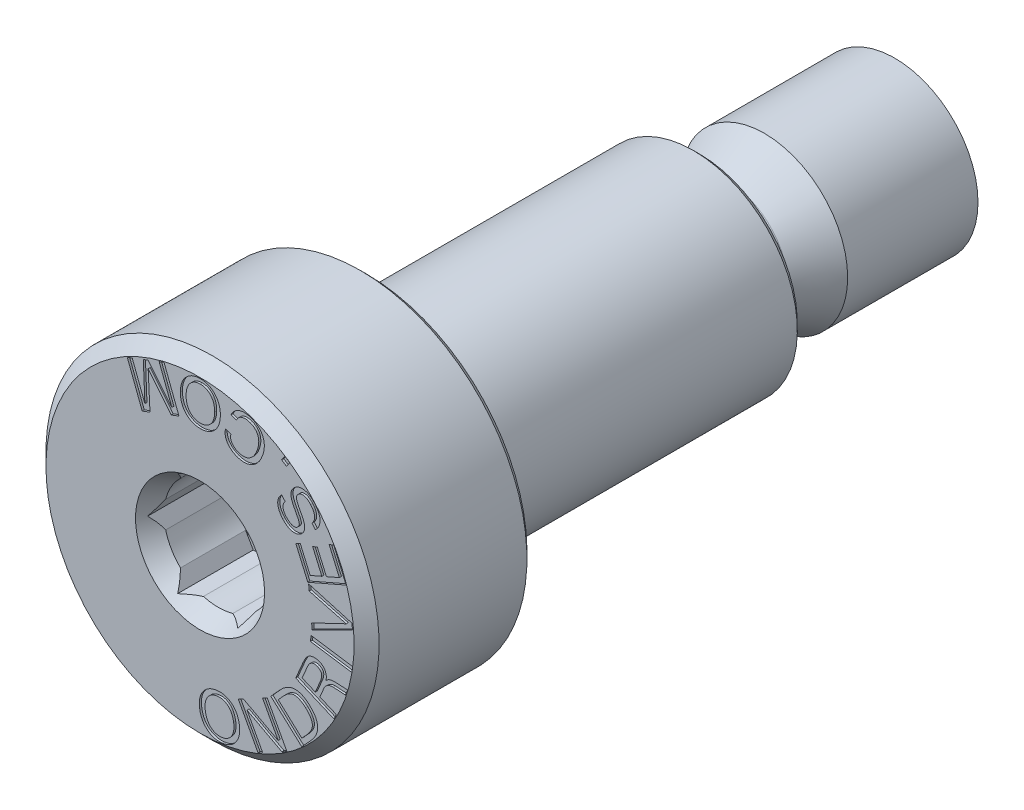
from build123d import *

# Parameters (mm, degrees)
HEX_2_DEPTH                 = 2
SHOULDER_CHAMFER_SIZE       = 0.15
HEAD_CHAMFER_SIZE           = 0.3
HEAD_UNDERSIDE_CHAMFER_SIZE = 0.15
FILLET1_R                   = 0.2
FILLET2_R                   = 0.2
CUT_EXTRUDE1_DEPTH          = 0.05


with BuildPart() as part:
    # Sketch1 → BODY (revolve)
    with BuildSketch(Plane(origin=(0, 0, 0), x_dir=(0, 0, -1), z_dir=(1, 0, 0))):
        Polygon((0, 2.4935), (0, 4), (-4, 4), (-4, 0), (13, 0), (13, 2), (8, 2), (8, 2.4935), align=None)
    revolve(axis=Axis((0, 0, 4), (0, 0, 1)))

    # Sketch2 → HEX DRILL (revolve, cut)
    with BuildSketch(Plane(origin=(0, 0, 0), x_dir=(0, 0, -1), z_dir=(1, 0, 0))):
        Polygon((-4, 0), (-0.819482056, 0), (-1.6, 1.299), (-3.565255247, 1.299), (-4, 1.55), align=None)
    revolve(axis=Axis((0, 0, 0.819482056), (0, 0, -1)), mode=Mode.SUBTRACT)

    # Sketch3 → HEX 2 (cut)
    with BuildSketch(Plane.XY.offset(4)):
        Polygon((0.721687836, 1.25), (-0.721687836, 1.25), (-1.443375673, 0), (-0.721687836, -1.25), (0.721687836, -1.25), (1.443375673, 0), align=None)
    extrude(amount=-HEX_2_DEPTH, mode=Mode.SUBTRACT)

    # SHOULDER CHAMFER
    shoulder_chamfer_edges = [part.edges().sort_by_distance(p)[0] for p in [
        (0, -2.4935, -8),
    ]]
    chamfer(shoulder_chamfer_edges, length=SHOULDER_CHAMFER_SIZE)

    # HEAD CHAMFER
    head_chamfer_edges = [part.edges().sort_by_distance(p)[0] for p in [
        (0, -4, 4),
    ]]
    chamfer(head_chamfer_edges, length=HEAD_CHAMFER_SIZE)

    # HEAD UNDERSIDE CHAMFER
    head_underside_chamfer_edges = [part.edges().sort_by_distance(p)[0] for p in [
        (0, -4, 0),
    ]]
    chamfer(head_underside_chamfer_edges, length=HEAD_UNDERSIDE_CHAMFER_SIZE)

    # Sketch4 → Cut-Revolve2 (revolve, cut)
    with BuildSketch(Plane(origin=(0, 0, 0), x_dir=(0, 0, -1), z_dir=(1, 0, 0))):
        with BuildLine():
            Line((0.2, 2.21), (0.6, 2.21))
            Line((0.6, 2.21), (0.8835, 2.4935))
            Line((0.8835, 2.4935), (0.018264615, 2.4935))
            ThreePointArc((0.018264615, 2.4935), (0.031625418, 2.302064834), (0.2, 2.21))
        make_face()
    revolve(axis=Axis((0, 0, 0), (0, 0, -1)), mode=Mode.SUBTRACT)

    # Fillet1
    fillet1_edges = [part.edges().sort_by_distance(p)[0] for p in [
        (0, -2.21, -0.6),
    ]]
    fillet(fillet1_edges, radius=FILLET1_R)

    # Sketch5 → Cut-Revolve4 (revolve, cut)
    with BuildSketch(Plane(origin=(0, 0, 0), x_dir=(0, 0, -1), z_dir=(1, 0, 0))):
        with BuildLine():
            Line((0.018264615, 2.4935), (0, 2.4935))
            Line((0, 2.4935), (0, 2.41))
            ThreePointArc((0, 2.41), (0.395380497, 2.367262879), (0.018264615, 2.4935))
        make_face()
    revolve(axis=Axis((0, 0, 0), (0, 0, -1)), mode=Mode.SUBTRACT)

    # Sketch6 → Cut-Revolve3 (revolve, cut)
    with BuildSketch(Plane(origin=(0, 0, 0), x_dir=(0, 0, -1), z_dir=(1, 0, 0))):
        with BuildLine():
            Line((8.4, 1.45), (8.6, 1.45))
            Line((8.6, 1.45), (9.552627944, 2))
            Line((9.552627944, 2), (8, 2))
            Line((8, 2), (8, 1.85))
            ThreePointArc((8, 1.85), (8.117157288, 1.567157288), (8.4, 1.45))
        make_face()
        Polygon((13, 2), (13, 1.45), (12.682457352, 2), align=None)
    revolve(axis=Axis((0, 0, 0), (0, 0, -1)), mode=Mode.SUBTRACT)

    # Fillet2
    fillet2_edges = [part.edges().sort_by_distance(p)[0] for p in [
        (0, -1.45, -8.6),
    ]]
    fillet(fillet2_edges, radius=FILLET2_R)

    # Sketch7 → Cut-Extrude1 (cut)
    # profile 1 of 12: a face of its own
    with BuildSketch(Plane.XY.offset(4)):
        with BuildLine():
            add(Edge.make_bspline(
                [(0.392857143, -2.608076299), (0.409944291, -2.605996782), (0.443492826, -2.601913905), (0.49340195, -2.601364969), (0.541595046, -2.605606119), (0.588055051, -2.614529224), (0.632803978, -2.628139768), (0.675726199, -2.646784319), (0.716856609, -2.67032592), (0.756057419, -2.698201204), (0.79261526, -2.73019233), (0.825518216, -2.766098362), (0.854951368, -2.805229793), (0.880478803, -2.847936501), (0.901823778, -2.894251183), (0.920031125, -2.943791126), (0.934291651, -2.996841907), (0.940446494, -3.033676732), (0.943587662, -3.052475649)],
                knots=[0, 0, 0, 0, 1.038003315, 2.037993161, 3.004982196, 3.952684401, 4.887378919, 5.821458422, 6.77011804, 7.741772548, 8.719272317, 9.695544412, 10.675052872, 11.668961054, 12.691443159, 13.747621115, 14.850482264, 16, 16, 16, 16], degree=3))
            add(Edge.make_bspline(
                [(0.943587662, -3.052475649), (0.946010205, -3.071386096), (0.950755602, -3.108428828), (0.95221853, -3.163305086), (0.94946001, -3.21597603), (0.942368216, -3.266473163), (0.9299794, -3.314680114), (0.913403128, -3.360688831), (0.892109675, -3.404496286), (0.86641199, -3.445611187), (0.837123586, -3.483816191), (0.804288481, -3.517991731), (0.768586148, -3.548284593), (0.729748408, -3.574454124), (0.687768746, -3.596357318), (0.642825538, -3.614249625), (0.594923457, -3.628243101), (0.561623757, -3.633970563), (0.544642857, -3.636891234)],
                knots=[0, 0, 0, 0, 1.149806952, 2.252299548, 3.306879543, 4.329704194, 5.32358445, 6.304847134, 7.275973205, 8.256768914, 9.225808524, 10.17553937, 11.110990128, 12.046040113, 12.995376215, 13.962479904, 14.960983915, 16, 16, 16, 16], degree=3))
            add(Edge.make_bspline(
                [(0.544642857, -3.636891234), (0.527487543, -3.638977032), (0.493802378, -3.643072583), (0.443703164, -3.643532139), (0.395292341, -3.639614172), (0.348593724, -3.630694818), (0.303676697, -3.616726497), (0.260395714, -3.598258892), (0.21902632, -3.574636014), (0.179627742, -3.546765961), (0.142866639, -3.514838672), (0.109952092, -3.478867286), (0.080523958, -3.439691302), (0.054869831, -3.397076403), (0.033090063, -3.350969898), (0.015396525, -3.301436979), (0.000890312, -3.24862543), (-0.005200434, -3.211906319), (-0.008319805, -3.193100649)],
                knots=[0, 0, 0, 0, 1.040160315, 2.042397535, 3.011327481, 3.96129936, 4.899378268, 5.839233499, 6.789703145, 7.762905742, 8.741685769, 9.716175024, 10.693894732, 11.688085062, 12.706746762, 13.759601857, 14.852581481, 16, 16, 16, 16], degree=3))
            add(Edge.make_bspline(
                [(-0.008319805, -3.193100649), (-0.010744854, -3.174122126), (-0.015478411, -3.137077124), (-0.016922428, -3.082140496), (-0.014298386, -3.029507284), (-0.006778117, -2.978997739), (0.005446446, -2.930754459), (0.022038243, -2.884635348), (0.043583725, -2.840877031), (0.069455093, -2.799743937), (0.099028263, -2.761546421), (0.131932243, -2.72718034), (0.167933298, -2.696818824), (0.207078091, -2.670819264), (0.249206885, -2.648798763), (0.294228146, -2.630671502), (0.342381253, -2.616739054), (0.37581067, -2.611001842), (0.392857143, -2.608076299)],
                knots=[0, 0, 0, 0, 1.150991414, 2.246669977, 3.302690165, 4.31953488, 5.31488737, 6.293707363, 7.264202467, 8.244714458, 9.213833658, 10.166956776, 11.103191265, 12.042677806, 12.989650693, 13.95964181, 14.959571765, 16, 16, 16, 16], degree=3))
        make_face()
        with BuildLine():
            add(Edge.make_bspline(
                [(0.526582792, -3.524472403), (0.538738437, -3.522327562), (0.56255723, -3.518124782), (0.596885721, -3.508140855), (0.628914554, -3.494899745), (0.658765984, -3.478537545), (0.686507708, -3.459204376), (0.71201223, -3.436722435), (0.735256029, -3.411184808), (0.756089503, -3.382738626), (0.77451326, -3.35175448), (0.789139738, -3.318128213), (0.800942518, -3.282512776), (0.808860186, -3.244653118), (0.813796377, -3.204606075), (0.815073313, -3.162446743), (0.813034099, -3.118082665), (0.80919853, -3.088033748), (0.807224026, -3.072564935)],
                knots=[0, 0, 0, 0, 0.987975974, 1.935923156, 2.856371812, 3.758174173, 4.656798552, 5.558747319, 6.47515452, 7.416641387, 8.378172633, 9.355518478, 10.34733305, 11.377900405, 12.447531076, 13.574871874, 14.751573839, 16, 16, 16, 16], degree=3))
            add(Edge.make_bspline(
                [(0.807224026, -3.072564935), (0.804648273, -3.05724022), (0.799621966, -3.027335668), (0.788973688, -2.984244525), (0.775297645, -2.944322792), (0.759280895, -2.9074352), (0.740847982, -2.873441004), (0.719476733, -2.84274361), (0.695533706, -2.815053174), (0.669184137, -2.790603332), (0.64105949, -2.769279656), (0.61152788, -2.751524354), (0.580827587, -2.737391201), (0.548979621, -2.726791398), (0.51598794, -2.719631128), (0.481826701, -2.716227037), (0.446518568, -2.716387616), (0.422803601, -2.719242633), (0.410714286, -2.720698052)],
                knots=[0, 0, 0, 0, 1.249303025, 2.437882089, 3.564513094, 4.638678557, 5.668337911, 6.668690425, 7.640359467, 8.606333552, 9.553831924, 10.473572194, 11.371618306, 12.266016862, 13.167482487, 14.080507821, 15.021489362, 16, 16, 16, 16], degree=3))
            add(Edge.make_bspline(
                [(0.410714286, -2.720698052), (0.398553413, -2.722825947), (0.374641613, -2.727010005), (0.340249317, -2.737289116), (0.307973973, -2.750453176), (0.277938092, -2.766848099), (0.249910728, -2.786148467), (0.224343025, -2.808858436), (0.200819406, -2.834372662), (0.179781587, -2.862828387), (0.161240358, -2.893775689), (0.146189824, -2.92729533), (0.134628335, -2.962958193), (0.126532805, -3.00084153), (0.121775781, -3.040844677), (0.120109397, -3.082987751), (0.12225783, -3.127291816), (0.126077508, -3.157340004), (0.128043831, -3.172808442)],
                knots=[0, 0, 0, 0, 0.98578933, 1.938347571, 2.86175514, 3.766305235, 4.667376931, 5.574957677, 6.492987375, 7.435603514, 8.397758293, 9.370211219, 10.364968355, 11.387971388, 12.460599677, 13.580239302, 14.754336925, 16, 16, 16, 16], degree=3))
            add(Edge.make_bspline(
                [(0.128043831, -3.172808442), (0.130584397, -3.188142609), (0.135534032, -3.218017258), (0.146629514, -3.260848104), (0.159900935, -3.300789287), (0.176210587, -3.33753623), (0.194830414, -3.371488525), (0.216263651, -3.402230251), (0.24007467, -3.430177324), (0.266713914, -3.454556921), (0.295019686, -3.475899606), (0.324759808, -3.493648485), (0.355661293, -3.507781098), (0.387711631, -3.518379363), (0.420905096, -3.525539877), (0.455267809, -3.528941336), (0.490711109, -3.528790733), (0.514493408, -3.525927756), (0.526582792, -3.524472403)],
                knots=[0, 0, 0, 0, 1.246392284, 2.428272094, 3.545393326, 4.619238309, 5.649118157, 6.647139958, 7.620652302, 8.588354935, 9.53798128, 10.460236012, 11.361122493, 12.258586807, 13.163256899, 14.079553684, 15.023769186, 16, 16, 16, 16], degree=3))
        make_face(mode=Mode.SUBTRACT)
    # profile 2 of 12: a face of its own
    with BuildSketch(Plane.XY.offset(4)):
        Polygon((2.087580961, -3.039495153), (1.967654013, -3.104024373), (1.129788753, -2.655972425), (1.504991675, -3.353009763), (1.394196221, -3.412668854), (0.918749792, -2.529551971), (1.038067974, -2.465225672), (1.875933234, -2.91327762), (1.500730312, -2.216240282), (1.612134532, -2.156378269), align=None)
    # profile 3 of 12: a face of its own
    with BuildSketch(Plane.XY.offset(4)):
        with BuildLine():
            Line((1.699921706, -2.081029823), (1.915424953, -1.845031446))
            add(Edge.make_bspline(
                [(1.915424953, -1.845031446), (1.929693192, -1.829942814), (1.957327444, -1.800719653), (2.000919792, -1.76160274), (2.04464792, -1.728083574), (2.088601928, -1.700080686), (2.132755508, -1.677474041), (2.177228823, -1.660747034), (2.221846597, -1.649310202), (2.26672133, -1.643798482), (2.311777678, -1.644052786), (2.356935906, -1.649829275), (2.402288044, -1.661116377), (2.447729439, -1.678119148), (2.493170047, -1.701005301), (2.538836943, -1.72911801), (2.584761319, -1.762733652), (2.614014071, -1.788512808), (2.629101901, -1.801809044)],
                knots=[0, 0, 0, 0, 1.21490475, 2.352987131, 3.423389498, 4.435896103, 5.398940926, 6.320913209, 7.210897382, 8.088291991, 8.959161664, 9.840974181, 10.746319392, 11.688216062, 12.674261419, 13.719091789, 14.823565309, 16, 16, 16, 16], degree=3))
            add(Edge.make_bspline(
                [(2.629101901, -1.801809044), (2.644075576, -1.815923572), (2.673140972, -1.843321278), (2.711709565, -1.88692244), (2.744870317, -1.930574262), (2.77228429, -1.974647755), (2.794281244, -2.018926121), (2.810211852, -2.063714982), (2.820709299, -2.108705584), (2.825735551, -2.154020315), (2.824631839, -2.199648107), (2.817750408, -2.245455124), (2.805499993, -2.291553767), (2.787370672, -2.337877628), (2.763626881, -2.38438877), (2.734427041, -2.431263995), (2.699337797, -2.478200499), (2.672809431, -2.508427205), (2.659134368, -2.524008719)],
                knots=[0, 0, 0, 0, 1.190504873, 2.310888595, 3.364818141, 4.359976138, 5.310716772, 6.220867259, 7.105014897, 7.979216468, 8.852488288, 9.73892131, 10.654369589, 11.6075254, 12.612530503, 13.672839738, 14.800376086, 16, 16, 16, 16], degree=3))
            Line((2.659134368, -2.524008719), (2.443631121, -2.760007096))
            Line((2.443631121, -2.760007096), (1.699921706, -2.081029823))
        make_face()
        with BuildLine():
            Line((2.445254498, -2.581029823), (2.569036965, -2.445477875))
            add(Edge.make_bspline(
                [(2.569036965, -2.445477875), (2.580656332, -2.432308419), (2.602956891, -2.407032839), (2.632098938, -2.368127629), (2.656166718, -2.330412558), (2.674556195, -2.293440684), (2.688124378, -2.257681652), (2.6959121, -2.222765259), (2.698899298, -2.188911312), (2.695798925, -2.155938045), (2.688137061, -2.123812331), (2.677377968, -2.091762457), (2.662849936, -2.059841499), (2.644672742, -2.028082592), (2.622752507, -1.996608159), (2.597472933, -1.965084751), (2.568671746, -1.933545481), (2.547330101, -1.913544797), (2.536366511, -1.903270083)],
                knots=[0, 0, 0, 0, 1.337153383, 2.566342045, 3.698361972, 4.739725707, 5.70627822, 6.603674714, 7.456334301, 8.283750727, 9.113553327, 9.967208358, 10.854881444, 11.780133249, 12.750426554, 13.773016635, 14.855958244, 16, 16, 16, 16], degree=3))
            add(Edge.make_bspline(
                [(2.536366511, -1.903270083), (2.525379625, -1.893607126), (2.504029168, -1.874829416), (2.471086955, -1.84948081), (2.438132755, -1.827938302), (2.405503145, -1.809751163), (2.372991402, -1.795186898), (2.340748104, -1.784114415), (2.308571218, -1.776786386), (2.276553216, -1.772629045), (2.244035396, -1.773159725), (2.21102442, -1.779206355), (2.177471077, -1.790933666), (2.143261276, -1.807770047), (2.108484037, -1.829957768), (2.073091661, -1.857376426), (2.037140889, -1.890227527), (2.013951459, -1.91481214), (2.001869758, -1.927620732)],
                knots=[0, 0, 0, 0, 1.130369586, 2.196610441, 3.208432335, 4.169894706, 5.079982318, 5.957600745, 6.799443772, 7.625978541, 8.44667622, 9.301671199, 10.207396311, 11.184443287, 12.241485861, 13.389300916, 14.639824903, 16, 16, 16, 16], degree=3))
            Line((2.001869758, -1.927620732), (1.87808729, -2.06317268))
            Line((1.87808729, -2.06317268), (2.445254498, -2.581029823))
        make_face(mode=Mode.SUBTRACT)
    # profile 4 of 12: a face of its own
    with BuildSketch(Plane.XY.offset(4)):
        with BuildLine():
            Line((3.546720265, -1.029082384), (3.490307927, -1.160981734))
            Line((3.490307927, -1.160981734), (3.207840395, -1.14292167))
            add(Edge.make_bspline(
                [(3.207840395, -1.14292167), (3.195514336, -1.142622638), (3.171206386, -1.142032924), (3.13519254, -1.147538297), (3.100630112, -1.158205278), (3.067834295, -1.17376971), (3.037785536, -1.193931771), (3.011569697, -1.218657633), (2.989632096, -1.247814351), (2.979054336, -1.269877444), (2.973668317, -1.281111605)],
                knots=[0, 0, 0, 0, 1.018563735, 2.008687244, 2.998241207, 4.002061673, 5.001676834, 5.979514034, 6.971202108, 8, 8, 8, 8], degree=3))
            Line((2.973668317, -1.281111605), (2.877686174, -1.506355111))
            Line((2.877686174, -1.506355111), (3.271355005, -1.674374592))
            Line((3.271355005, -1.674374592), (3.219204031, -1.79633076))
            Line((3.219204031, -1.79633076), (2.298952408, -1.40367654))
            Line((2.298952408, -1.40367654), (2.472856628, -0.996209007))
            add(Edge.make_bspline(
                [(2.472856628, -0.996209007), (2.480375152, -0.979343532), (2.494720184, -0.947164901), (2.518204708, -0.90263117), (2.542151159, -0.864031327), (2.56295329, -0.835762674), (2.580810389, -0.816490278), (2.594742504, -0.80354828), (2.610167523, -0.792477772), (2.626323325, -0.782393327), (2.643820794, -0.77411252), (2.662248951, -0.766985547), (2.681869768, -0.761288808), (2.709337556, -0.75570075), (2.744566905, -0.752304792), (2.787162674, -0.754302541), (2.829598786, -0.762843734), (2.856774492, -0.773207329), (2.870583901, -0.778473618)],
                knots=[0, 0, 0, 0, 1.70512306, 3.253304621, 4.645228063, 5.898403787, 6.486327414, 7.070020721, 7.651033447, 8.2370955, 8.826643183, 9.435726208, 10.060434962, 10.711002471, 12.022608216, 13.317263415, 14.636760106, 16, 16, 16, 16], degree=3))
            add(Edge.make_bspline(
                [(2.870583901, -0.778473618), (2.878287811, -0.781934379), (2.893456266, -0.788748373), (2.914811657, -0.800940902), (2.934263818, -0.814666033), (2.95242419, -0.829257587), (2.968501163, -0.845526722), (2.983144153, -0.862846374), (2.995739602, -0.881691825), (3.006626873, -0.901681854), (3.015781376, -0.922664712), (3.02314646, -0.94437017), (3.02833296, -0.966813823), (3.031975029, -0.98986535), (3.03292893, -1.013652372), (3.032644851, -1.038129472), (3.030222868, -1.063320122), (3.027034667, -1.080172126), (3.025413447, -1.088741475)],
                knots=[0, 0, 0, 0, 1.069422075, 2.105616455, 3.108690089, 4.082914408, 5.052303838, 6.001256995, 6.951833419, 7.918074794, 8.881157826, 9.848462341, 10.816942542, 11.796052859, 12.799858129, 13.828193683, 14.895623066, 16, 16, 16, 16], degree=3))
            Line((3.025413447, -1.088741475), (3.028051434, -1.089959007))
            add(Edge.make_bspline(
                [(3.028051434, -1.089959007), (3.034278844, -1.083248572), (3.046730934, -1.069830644), (3.069186687, -1.053455822), (3.093812472, -1.039442687), (3.121427134, -1.028803768), (3.151464987, -1.020625804), (3.184283905, -1.015795458), (3.219642702, -1.013182051), (3.24409295, -1.014032127), (3.256744616, -1.014471994)],
                knots=[0, 0, 0, 0, 0.878686172, 1.756986892, 2.659999839, 3.597508822, 4.594934075, 5.64851335, 6.783234305, 8, 8, 8, 8], degree=3))
            Line((3.256744616, -1.014471994), (3.546720265, -1.029082384))
        make_face()
        with BuildLine():
            Line((2.768514096, -1.459885955), (2.884382603, -1.188173293))
            add(Edge.make_bspline(
                [(2.884382603, -1.188173293), (2.888202697, -1.17901273), (2.895580486, -1.161320839), (2.90465155, -1.135060652), (2.912088417, -1.110324542), (2.917421644, -1.087005123), (2.920690424, -1.065159194), (2.922275371, -1.044796747), (2.921648762, -1.02589444), (2.919337084, -1.008269702), (2.91461148, -0.991864529), (2.907622126, -0.976386119), (2.898192761, -0.961932724), (2.886434018, -0.948449137), (2.872490081, -0.935765479), (2.856186442, -0.92406942), (2.837598703, -0.913190646), (2.824046345, -0.907194481), (2.817012473, -0.904082384)],
                knots=[0, 0, 0, 0, 1.411492425, 2.726029862, 3.949903519, 5.084314312, 6.125271904, 7.089786383, 7.985060685, 8.811006594, 9.611914552, 10.404222843, 11.218201161, 12.057268734, 12.942665136, 13.893403926, 14.906645734, 16, 16, 16, 16], degree=3))
            add(Edge.make_bspline(
                [(2.817012473, -0.904082384), (2.810630189, -0.901523465), (2.798181386, -0.89653223), (2.779327318, -0.891322028), (2.76106615, -0.887966257), (2.74335535, -0.886625539), (2.726203194, -0.887766742), (2.709531994, -0.89050443), (2.69350141, -0.895619898), (2.678094036, -0.902892374), (2.66315602, -0.912024587), (2.649030986, -0.923532506), (2.635272633, -0.936868895), (2.622117661, -0.952259741), (2.609786426, -0.969920638), (2.597796544, -0.989399472), (2.586410834, -1.010958591), (2.579636089, -1.026265374), (2.576143966, -1.034155436)],
                knots=[0, 0, 0, 0, 1.054097199, 2.05604291, 2.994289014, 3.899123989, 4.77223018, 5.625127461, 6.484876442, 7.343623093, 8.233400928, 9.163522538, 10.13208704, 11.169714566, 12.263705122, 13.432855381, 14.676735065, 16, 16, 16, 16], degree=3))
            Line((2.576143966, -1.034155436), (2.452158577, -1.324739851))
            Line((2.452158577, -1.324739851), (2.768514096, -1.459885955))
        make_face(mode=Mode.SUBTRACT)
    # profile 5 of 12: a face of its own
    with BuildSketch(Plane.XY.offset(4)):
        Polygon((3.663915677, -0.483458485), (3.643826392, -0.61576368), (2.649102366, -0.465195498), (2.669191651, -0.332890303), align=None)
    # profile 6 of 12: a face of its own
    with BuildSketch(Plane.XY.offset(4)):
        Polygon((2.608063825, 0.70989237), (3.648242396, 0.412611525), (3.661026487, 0.275639123), (2.693088176, -0.207721267), (2.679898241, -0.066081656), (3.511675838, 0.33103685), (2.62125376, 0.568049837), align=None)
    # profile 7 of 12: a face of its own
    with BuildSketch(Plane.XY.offset(4)):
        Polygon((3.209997955, 1.8205513), (3.508496332, 1.134268832), (2.588244708, 0.733903572), (2.299080747, 1.398879222), (2.408252825, 1.446362988), (2.644454124, 0.903343507), (2.925704124, 1.02570552), (2.704924903, 1.533416559), (2.814096981, 1.580900326), (3.034876202, 1.073189287), (3.346361592, 1.208741235), (3.100825877, 1.773067533), align=None)
    # profile 8 of 12: a face of its own
    with BuildSketch(Plane.XY.offset(4)):
        with BuildLine():
            add(Edge.make_bspline(
                [(2.743250583, 2.465013108), (2.754444657, 2.451961058), (2.776130671, 2.426675627), (2.804906451, 2.387646446), (2.828910702, 2.348957091), (2.848806133, 2.310989985), (2.864232318, 2.273455755), (2.875092689, 2.236393143), (2.881554693, 2.199838491), (2.883287359, 2.163933833), (2.881252325, 2.128981559), (2.875733123, 2.095135677), (2.867038035, 2.062538365), (2.854872887, 2.031142803), (2.839514194, 2.000856787), (2.82038773, 1.971976459), (2.798268992, 1.944160245), (2.781302445, 1.92717939), (2.772674285, 1.918543953)],
                knots=[0, 0, 0, 0, 1.340023787, 2.595996541, 3.775245837, 4.885954812, 5.933590996, 6.933045793, 7.890871631, 8.820043748, 9.728444802, 10.615181148, 11.488714882, 12.35330809, 13.235203311, 14.130177804, 15.049121406, 16, 16, 16, 16], degree=3))
            Line((2.772674285, 1.918543953), (2.687649934, 2.014526096))
            add(Edge.make_bspline(
                [(2.687649934, 2.014526096), (2.693724773, 2.021321409), (2.705618332, 2.034625541), (2.720996154, 2.055891952), (2.732906458, 2.078054534), (2.742508113, 2.100387645), (2.748674372, 2.123360932), (2.752620557, 2.146679713), (2.752759085, 2.170630397), (2.750556479, 2.194893529), (2.745763223, 2.219230868), (2.739102036, 2.243402234), (2.730286932, 2.267267483), (2.71950239, 2.290767875), (2.706846599, 2.314036454), (2.692225722, 2.336969347), (2.67551328, 2.359533295), (2.663246195, 2.374035313), (2.6570087, 2.381409212)],
                knots=[0, 0, 0, 0, 1.068329069, 2.091616828, 3.067561728, 4.013100556, 4.934690982, 5.849947378, 6.777930258, 7.733558383, 8.702518762, 9.681840922, 10.6703672, 11.681754962, 12.710864738, 13.773438714, 14.867851476, 16, 16, 16, 16], degree=3))
            add(Edge.make_bspline(
                [(2.6570087, 2.381409212), (2.650840604, 2.388088334), (2.638798704, 2.401127902), (2.620232695, 2.419393486), (2.600933551, 2.435069063), (2.58204859, 2.449510339), (2.562572507, 2.461450408), (2.543112665, 2.471714936), (2.523347821, 2.479886421), (2.50355714, 2.485918459), (2.484015421, 2.490083352), (2.464949315, 2.492008107), (2.446468454, 2.491372151), (2.428669899, 2.488529716), (2.411524689, 2.483455453), (2.395041644, 2.475974412), (2.379161787, 2.466289226), (2.369505397, 2.458177648), (2.364597986, 2.454055316)],
                knots=[0, 0, 0, 0, 1.294411605, 2.527063876, 3.70331965, 4.831939017, 5.908841973, 6.951176295, 7.961571539, 8.948520544, 9.892830534, 10.802171466, 11.669335002, 12.517905809, 13.361874313, 14.206666496, 15.088621783, 16, 16, 16, 16], degree=3))
            add(Edge.make_bspline(
                [(2.364597986, 2.454055316), (2.359740255, 2.449505501), (2.35027458, 2.440639823), (2.33843128, 2.425658828), (2.329053669, 2.410054749), (2.322073564, 2.393696966), (2.318196092, 2.376515515), (2.316224652, 2.358660691), (2.317106784, 2.34005897), (2.320859583, 2.320601561), (2.326688241, 2.299680394), (2.334766149, 2.276726397), (2.344749679, 2.251359976), (2.356753665, 2.223526423), (2.370950165, 2.193335486), (2.387541185, 2.160902747), (2.405861496, 2.125944207), (2.426433733, 2.089831308), (2.446394768, 2.053138135), (2.46429245, 2.017341516), (2.479471816, 1.983196044), (2.491604875, 1.950609766), (2.501531108, 1.919870221), (2.508491595, 1.890690852), (2.512856524, 1.863217106), (2.514613091, 1.837253441), (2.513528427, 1.812579428), (2.510248857, 1.788828104), (2.503750466, 1.766119667), (2.495261491, 1.744024325), (2.48378364, 1.723002772), (2.469918868, 1.702748586), (2.453284866, 1.683513734), (2.440673067, 1.671743785), (2.434200259, 1.665703044)],
                knots=[0, 0, 0, 0, 0.735159825, 1.432517468, 2.103380328, 2.74373814, 3.389576259, 4.043762555, 4.725051388, 5.439526592, 6.230654953, 7.124756486, 8.128956928, 9.24462687, 10.475925463, 11.817255027, 13.272679608, 14.839677302, 16.412590099, 17.89104848, 19.264096339, 20.54218844, 21.734407238, 22.83378731, 23.855658971, 24.807434168, 25.705749136, 26.582635056, 27.451831657, 28.311580188, 29.195044394, 30.093359362, 31.021446555, 32, 32, 32, 32], degree=3))
            add(Edge.make_bspline(
                [(2.434200259, 1.665703044), (2.426560641, 1.659295923), (2.411552687, 1.646709199), (2.386970537, 1.631244526), (2.361419053, 1.618982035), (2.334892951, 1.609732367), (2.307288682, 1.603843646), (2.278749083, 1.601207654), (2.249233396, 1.601963236), (2.218971401, 1.605561495), (2.188417249, 1.612428107), (2.158274351, 1.622684022), (2.128696599, 1.636007686), (2.099530151, 1.652312952), (2.070919774, 1.671940528), (2.042710349, 1.694521755), (2.014930314, 1.72012888), (1.99763994, 1.739157416), (1.988786298, 1.748901096)],
                knots=[0, 0, 0, 0, 0.941975065, 1.850500681, 2.737356084, 3.617264733, 4.500445161, 5.399760484, 6.321008068, 7.287315949, 8.277317462, 9.276512228, 10.292878708, 11.340932804, 12.431980532, 13.569743005, 14.755571942, 16, 16, 16, 16], degree=3))
            add(Edge.make_bspline(
                [(1.988786298, 1.748901096), (1.979766622, 1.759394442), (1.962126694, 1.779916453), (1.938911762, 1.812160229), (1.918317681, 1.844137865), (1.901611805, 1.876538657), (1.88746813, 1.908758487), (1.877035152, 1.941298833), (1.869318271, 1.973836072), (1.865274912, 2.006355824), (1.864614325, 2.03846327), (1.867441818, 2.069844639), (1.873713433, 2.100320918), (1.883738316, 2.129768111), (1.897555538, 2.158129561), (1.914665837, 2.185671039), (1.935518157, 2.212192204), (1.951557528, 2.228553156), (1.959768441, 2.236928693)],
                knots=[0, 0, 0, 0, 1.211354548, 2.369066012, 3.47681598, 4.539383951, 5.558418704, 6.555097224, 7.527986938, 8.483238738, 9.419434237, 10.335526345, 11.237137381, 12.138261707, 13.052397867, 13.994348874, 14.973262397, 16, 16, 16, 16], degree=3))
            Line((1.959768441, 2.236928693), (2.045807402, 2.139729018))
            add(Edge.make_bspline(
                [(2.045807402, 2.139729018), (2.04088521, 2.134142163), (2.031270163, 2.123228759), (2.019174706, 2.105623469), (2.008830902, 2.08795035), (2.000888586, 2.069828233), (1.99519977, 2.051432595), (1.991434871, 2.032811721), (1.990025096, 2.013863921), (1.990920982, 1.994682011), (1.993749611, 1.975214967), (1.998930903, 1.955540026), (2.006092063, 1.93549814), (2.015457182, 1.915191756), (2.027193374, 1.894693384), (2.040761004, 1.873739473), (2.056639648, 1.852653137), (2.068390137, 1.838935079), (2.074419415, 1.831896225)],
                knots=[0, 0, 0, 0, 1.033398098, 2.018647507, 2.961452747, 3.874431805, 4.760022597, 5.631596574, 6.507867735, 7.391862148, 8.294093321, 9.235258533, 10.212997658, 11.247206984, 12.336864352, 13.491349972, 14.712790061, 16, 16, 16, 16], degree=3))
            add(Edge.make_bspline(
                [(2.074419415, 1.831896225), (2.080523701, 1.825287412), (2.092405001, 1.812424108), (2.110567466, 1.794465042), (2.128986864, 1.77881225), (2.147105828, 1.764964685), (2.165286928, 1.753270974), (2.183452342, 1.743727228), (2.201479392, 1.735844006), (2.219558282, 1.730403871), (2.237241151, 1.726990418), (2.254376475, 1.725144294), (2.27093261, 1.725894934), (2.286848989, 1.728196168), (2.302110744, 1.732807664), (2.31674396, 1.739271083), (2.330756767, 1.747948716), (2.339312299, 1.755018228), (2.343697012, 1.758641355)],
                knots=[0, 0, 0, 0, 1.382597678, 2.691069347, 3.922316571, 5.094899959, 6.193547766, 7.239800557, 8.245772337, 9.212579725, 10.13406398, 11.011210013, 11.853796697, 12.67415997, 13.47667844, 14.295723435, 15.126557626, 16, 16, 16, 16], degree=3))
            add(Edge.make_bspline(
                [(2.343697012, 1.758641355), (2.347439465, 1.762141357), (2.354696828, 1.76892856), (2.363832206, 1.780261521), (2.371593099, 1.791888951), (2.377189142, 1.804261293), (2.38112526, 1.817086218), (2.38338606, 1.830314867), (2.38378465, 1.844110128), (2.382179922, 1.858581707), (2.379116264, 1.874300422), (2.373778753, 1.891549545), (2.36710225, 1.910872445), (2.358592373, 1.932177546), (2.347846907, 1.955245201), (2.335765442, 1.980425954), (2.321676485, 2.007450383), (2.306062665, 2.03575077), (2.290352386, 2.064520553), (2.275399488, 2.092556331), (2.261129277, 2.119072204), (2.248897426, 2.144715813), (2.236764582, 2.168593872), (2.226614487, 2.19155258), (2.217259957, 2.213054268), (2.20602511, 2.239662189), (2.19495113, 2.272590265), (2.18710547, 2.312849472), (2.183856748, 2.353476357), (2.184887611, 2.387542472), (2.189157874, 2.414624688), (2.194376426, 2.434642033), (2.201842365, 2.454203842), (2.211330395, 2.473299976), (2.223351205, 2.491807684), (2.237012705, 2.510066141), (2.253088383, 2.527682675), (2.264948264, 2.538691115), (2.271050908, 2.544355641)],
                knots=[0, 0, 0, 0, 0.637925236, 1.237064425, 1.810004238, 2.375890871, 2.922610967, 3.478421661, 4.043554114, 4.63667165, 5.289792956, 6.03678653, 6.884684338, 7.838139625, 8.894548069, 10.055954894, 11.319207522, 12.692538499, 14.084710045, 15.404917773, 16.653226838, 17.837182648, 18.945730424, 19.990977524, 20.965193393, 21.868615699, 23.590946773, 25.284099556, 26.967294202, 28.663278434, 29.517107714, 30.380087274, 31.236617961, 32.122681565, 33.032493824, 33.98352306, 34.962397489, 36, 36, 36, 36], degree=3))
            add(Edge.make_bspline(
                [(2.271050908, 2.544355641), (2.279148023, 2.551192225), (2.295083002, 2.5646465), (2.321345183, 2.580993179), (2.348451449, 2.594449221), (2.376861769, 2.604149652), (2.406260123, 2.610677181), (2.436752638, 2.613980915), (2.468383631, 2.613624763), (2.500864161, 2.610179641), (2.533571603, 2.603538022), (2.565893626, 2.593550515), (2.597337346, 2.580024424), (2.62817505, 2.563481773), (2.658270272, 2.543738884), (2.687533272, 2.520593506), (2.71628311, 2.494462301), (2.734133811, 2.474968865), (2.743250583, 2.465013108)],
                knots=[0, 0, 0, 0, 0.948949246, 1.867515228, 2.765206815, 3.656959416, 4.551491192, 5.46023653, 6.400191532, 7.381939106, 8.384498193, 9.387643978, 10.409242306, 11.44834661, 12.521418123, 13.631413418, 14.79030712, 16, 16, 16, 16], degree=3))
        make_face()
    # profile 9 of 12: a face of its own
    with BuildSketch(Plane.XY.offset(4)):
        Polygon((2.038489936, 3.082581122), (2.15415552, 3.002832746), (2.074407144, 2.887167161), (1.958741559, 2.966915538), align=None)
    # profile 10 of 12: a face of its own
    with BuildSketch(Plane.XY.offset(4)):
        with BuildLine():
            add(Edge.make_bspline(
                [(1.24078318, 3.467365493), (1.256879107, 3.461037277), (1.288274042, 3.448694159), (1.332220768, 3.425494841), (1.372162405, 3.399248483), (1.408382524, 3.370055031), (1.440242488, 3.337239208), (1.468247926, 3.301375899), (1.492048739, 3.262175325), (1.511687303, 3.220100592), (1.527119728, 3.175796636), (1.53774199, 3.12959771), (1.543339685, 3.081906225), (1.544285248, 3.03264688), (1.540622691, 2.981896293), (1.53188586, 2.929652326), (1.518488371, 2.875911764), (1.506209023, 2.840184189), (1.499914674, 2.821870363)],
                knots=[0, 0, 0, 0, 1.05648818, 2.06066912, 3.030764249, 3.974131919, 4.898010562, 5.820120642, 6.749689399, 7.694803939, 8.653199427, 9.61197829, 10.586319316, 11.582913945, 12.619178978, 13.69172413, 14.81678611, 16, 16, 16, 16], degree=3))
            add(Edge.make_bspline(
                [(1.499914674, 2.821870363), (1.492974402, 2.803816668), (1.479420055, 2.76855781), (1.454575989, 2.719057669), (1.427815213, 2.673432002), (1.397626953, 2.632545384), (1.365524274, 2.595260103), (1.330150465, 2.562673558), (1.292236229, 2.534268609), (1.251880875, 2.510338672), (1.209683908, 2.491074627), (1.166250795, 2.476493432), (1.121717007, 2.467090774), (1.076175074, 2.462904165), (1.029640055, 2.463492414), (0.98213065, 2.469347421), (0.933597339, 2.480089246), (0.901611734, 2.490872145), (0.8852637, 2.49638335)],
                knots=[0, 0, 0, 0, 1.181824211, 2.308102215, 3.381841647, 4.411615441, 5.411007707, 6.385483143, 7.345709958, 8.302439773, 9.24805866, 10.176531745, 11.097886447, 12.024146683, 12.967085271, 13.937551299, 14.945870081, 16, 16, 16, 16], degree=3))
            add(Edge.make_bspline(
                [(0.8852637, 2.49638335), (0.872808936, 2.501207118), (0.848333368, 2.510686581), (0.813481102, 2.527801487), (0.781190851, 2.54721979), (0.750928225, 2.568247682), (0.7232802, 2.591689007), (0.698011211, 2.617194786), (0.674984344, 2.644628204), (0.654577444, 2.673985239), (0.63697776, 2.704539883), (0.6228016, 2.735983787), (0.612379378, 2.768113345), (0.60549866, 2.800769105), (0.60199121, 2.834023956), (0.602031272, 2.867818898), (0.605573322, 2.90227358), (0.610867265, 2.925000094), (0.613551038, 2.936521337)],
                knots=[0, 0, 0, 0, 1.12473592, 2.210282818, 3.265637076, 4.296307639, 5.31112213, 6.314353437, 7.317471474, 8.324336841, 9.322246789, 10.283771262, 11.224352862, 12.161944007, 13.090068863, 14.035916783, 15.004304809, 16, 16, 16, 16], degree=3))
            Line((0.613551038, 2.936521337), (0.741797791, 2.889443415))
            add(Edge.make_bspline(
                [(0.741797791, 2.889443415), (0.739938558, 2.881899488), (0.736300837, 2.867139262), (0.733774323, 2.844736606), (0.733221604, 2.822837602), (0.735386465, 2.801285379), (0.739521281, 2.780140929), (0.746448839, 2.75947365), (0.755276881, 2.739114069), (0.766762393, 2.719506297), (0.780083015, 2.70064682), (0.795393391, 2.683002192), (0.812304742, 2.666438079), (0.831082049, 2.651207309), (0.85155846, 2.637184668), (0.873877729, 2.624691887), (0.897635767, 2.612939578), (0.914428379, 2.606440527), (0.923007206, 2.603120363)],
                knots=[0, 0, 0, 0, 0.9930218, 1.942917469, 2.877635443, 3.79034457, 4.708452455, 5.627905075, 6.573296783, 7.542506405, 8.52932554, 9.523289468, 10.526849891, 11.553972925, 12.612439648, 13.697559506, 14.823754125, 16, 16, 16, 16], degree=3))
            add(Edge.make_bspline(
                [(0.923007206, 2.603120363), (0.934709927, 2.599170324), (0.957632571, 2.591433207), (0.992456371, 2.583948252), (1.02653112, 2.580157785), (1.059892685, 2.580386904), (1.092497244, 2.584241582), (1.124412711, 2.591736392), (1.155447699, 2.60332497), (1.185710987, 2.618311627), (1.214817392, 2.637040845), (1.242327069, 2.659552474), (1.268138951, 2.685625431), (1.292138207, 2.715382835), (1.314758917, 2.748482797), (1.33524359, 2.785472171), (1.354783226, 2.825649583), (1.365665783, 2.854243846), (1.371262076, 2.868948285)],
                knots=[0, 0, 0, 0, 1.004487781, 1.967535231, 2.892107057, 3.789353609, 4.676257845, 5.558778391, 6.450435622, 7.366182671, 8.302154115, 9.260707765, 10.253239823, 11.282282526, 12.367795435, 13.511415834, 14.720259528, 16, 16, 16, 16], degree=3))
            add(Edge.make_bspline(
                [(1.371262076, 2.868948285), (1.376396784, 2.883767549), (1.386388776, 2.912605409), (1.397714154, 2.955745199), (1.405815581, 2.997208957), (1.410166824, 3.037059699), (1.410818608, 3.075237154), (1.408022193, 3.111733998), (1.401811436, 3.146669885), (1.391822403, 3.179786094), (1.378622847, 3.210846498), (1.362568586, 3.23973052), (1.343348903, 3.266039738), (1.321206327, 3.289980566), (1.296189914, 3.311652286), (1.267862151, 3.330418365), (1.236929652, 3.347346149), (1.214647326, 3.356131756), (1.203242596, 3.36062848)],
                knots=[0, 0, 0, 0, 1.280761792, 2.492325384, 3.639921193, 4.729098585, 5.762481962, 6.754549626, 7.714794143, 8.655249603, 9.573763774, 10.466796135, 11.348734282, 12.228523556, 13.12570002, 14.045194206, 14.999474711, 16, 16, 16, 16], degree=3))
            add(Edge.make_bspline(
                [(1.203242596, 3.36062848), (1.194215747, 3.363723016), (1.17652678, 3.369787054), (1.149951914, 3.376682908), (1.124115587, 3.381415624), (1.098998651, 3.383932865), (1.074558572, 3.384077704), (1.050765704, 3.382378364), (1.027695102, 3.378195951), (1.005342912, 3.37222935), (0.984067981, 3.363881995), (0.963978419, 3.353540783), (0.94543175, 3.340785588), (0.928111757, 3.326088802), (0.911941009, 3.309394259), (0.897351138, 3.29030484), (0.883867396, 3.269235205), (0.876327377, 3.253970302), (0.872479609, 3.246180428)],
                knots=[0, 0, 0, 0, 1.173568111, 2.299718128, 3.373659328, 4.401986356, 5.400526202, 6.376944805, 7.331817498, 8.280543385, 9.218480022, 10.137739183, 11.053980662, 11.980890447, 12.928338343, 13.906988034, 14.93190927, 16, 16, 16, 16], degree=3))
            Line((0.872479609, 3.246180428), (0.744232856, 3.29325835))
            add(Edge.make_bspline(
                [(0.744232856, 3.29325835), (0.750023406, 3.30495234), (0.761354717, 3.327835872), (0.781862494, 3.359285282), (0.804104979, 3.387822841), (0.828373538, 3.41329273), (0.855040739, 3.435317589), (0.883570535, 3.454429705), (0.914393405, 3.469950661), (0.946918467, 3.482647189), (0.980916858, 3.491742969), (1.015775914, 3.498268573), (1.051540805, 3.500913682), (1.087997245, 3.500810949), (1.12523673, 3.497163047), (1.163264879, 3.490736795), (1.202039634, 3.480729646), (1.227717317, 3.471872416), (1.24078318, 3.467365493)],
                knots=[0, 0, 0, 0, 1.069914648, 2.093675835, 3.074047635, 4.035750925, 4.973764462, 5.906591516, 6.847326742, 7.799679839, 8.766414705, 9.730948493, 10.705316367, 11.70434699, 12.718859319, 13.771811424, 14.866205899, 16, 16, 16, 16], degree=3))
        make_face()
    # profile 11 of 12: a face of its own
    with BuildSketch(Plane.XY.offset(4)):
        with BuildLine():
            add(Edge.make_bspline(
                [(0.005160268, 2.638694489), (-0.012046305, 2.63916462), (-0.045789106, 2.640086567), (-0.095094648, 2.647255073), (-0.142100714, 2.658199133), (-0.18651089, 2.674230712), (-0.228716051, 2.694367548), (-0.26833418, 2.719239451), (-0.305536268, 2.748558719), (-0.340085547, 2.781865715), (-0.371328204, 2.818979796), (-0.398561239, 2.859263509), (-0.421667104, 2.902353561), (-0.44036005, 2.948366071), (-0.454964009, 2.997152657), (-0.465257537, 3.048847014), (-0.471450431, 3.103300597), (-0.472023089, 3.140571797), (-0.472315381, 3.159595463)],
                knots=[0, 0, 0, 0, 1.039348275, 2.038204887, 3.004803674, 3.951167327, 4.885351194, 5.825524737, 6.771579405, 7.742842218, 8.720440083, 9.697653361, 10.675977255, 11.669542907, 12.693702743, 13.748606809, 14.850861938, 16, 16, 16, 16], degree=3))
            add(Edge.make_bspline(
                [(-0.472315381, 3.159595463), (-0.471888088, 3.178621247), (-0.471050689, 3.215907527), (-0.464459005, 3.270364861), (-0.45375268, 3.321902822), (-0.438918968, 3.370589815), (-0.419835096, 3.41634768), (-0.396586223, 3.459301569), (-0.36903074, 3.49929766), (-0.337438145, 3.536061898), (-0.302686414, 3.569216386), (-0.265339049, 3.598372014), (-0.225388069, 3.622752913), (-0.183150829, 3.642756909), (-0.138533733, 3.658316822), (-0.091517327, 3.669137286), (-0.042111894, 3.675835135), (-0.00838967, 3.676503096), (0.008812866, 3.67684384)],
                knots=[0, 0, 0, 0, 1.149700404, 2.253155535, 3.309955033, 4.327719119, 5.324642924, 6.301539762, 7.274536352, 8.254542212, 9.226154964, 10.173139457, 11.112708319, 12.049042824, 12.992906921, 13.962772019, 14.960759898, 16, 16, 16, 16], degree=3))
            add(Edge.make_bspline(
                [(0.008812866, 3.67684384), (0.026082187, 3.676343377), (0.059940852, 3.675362158), (0.109522592, 3.66862141), (0.156648039, 3.657262029), (0.201287431, 3.641317689), (0.243680105, 3.621242169), (0.28334085, 3.596152329), (0.320989402, 3.567140861), (0.355396906, 3.533388198), (0.38692552, 3.496377402), (0.414392416, 3.456131933), (0.437412274, 3.412929316), (0.456374971, 3.367076318), (0.471002235, 3.318323223), (0.481172474, 3.266741592), (0.487738736, 3.21239027), (0.488256144, 3.17517256), (0.488520658, 3.156145788)],
                knots=[0, 0, 0, 0, 1.041588965, 2.042165541, 3.011979733, 3.960515261, 4.896729041, 5.835242745, 6.786057145, 7.758442793, 8.736946844, 9.714727562, 10.691324262, 11.684687216, 12.703131539, 13.756173213, 14.852890697, 16, 16, 16, 16], degree=3))
            add(Edge.make_bspline(
                [(0.488520658, 3.156145788), (0.488095183, 3.137119438), (0.487261349, 3.099832049), (0.480644117, 3.045382664), (0.47002496, 2.993796752), (0.454858926, 2.945192074), (0.435832401, 2.899297492), (0.412426569, 2.856269143), (0.384618828, 2.816235746), (0.352825836, 2.77947398), (0.317880842, 2.746302058), (0.280339203, 2.717249165), (0.240397581, 2.692665893), (0.197777184, 2.673048701), (0.153076767, 2.657215782), (0.10582678, 2.646390395), (0.056287757, 2.639704003), (0.022430559, 2.639035491), (0.005160268, 2.638694489)],
                knots=[0, 0, 0, 0, 1.147040321, 2.247942367, 3.302296727, 4.318909556, 5.313526759, 6.293695427, 7.26676028, 8.247158067, 9.219478886, 10.167498128, 11.104893091, 12.04101819, 12.99174495, 13.959366053, 14.959088682, 16, 16, 16, 16], degree=3))
        make_face()
        with BuildLine():
            add(Edge.make_bspline(
                [(0.009827476, 3.563207476), (-0.002432287, 3.562990109), (-0.02651333, 3.562563148), (-0.061814319, 3.557551104), (-0.095419228, 3.549277615), (-0.127347707, 3.537544787), (-0.15771721, 3.522858629), (-0.186165245, 3.504244922), (-0.212991399, 3.48251979), (-0.237927597, 3.457481785), (-0.260734176, 3.429660431), (-0.280159044, 3.398609029), (-0.297218557, 3.365323287), (-0.310636212, 3.329084801), (-0.32159323, 3.290379588), (-0.328704777, 3.248873451), (-0.333930139, 3.204842829), (-0.334461121, 3.174561037), (-0.334734212, 3.158986697)],
                knots=[0, 0, 0, 0, 0.98274288, 1.930336887, 2.852761303, 3.753861916, 4.654063757, 5.552481737, 6.474379469, 7.418129329, 8.382397553, 9.353191609, 10.350429456, 11.377233232, 12.447425541, 13.572277208, 14.751388935, 16, 16, 16, 16], degree=3))
            add(Edge.make_bspline(
                [(-0.334734212, 3.158986697), (-0.334475578, 3.143419443), (-0.333973019, 3.113170374), (-0.329676479, 3.069070974), (-0.322460368, 3.027590345), (-0.312190548, 2.988702287), (-0.298711121, 2.95248537), (-0.282317964, 2.918933356), (-0.262868354, 2.887975485), (-0.240600189, 2.85982337), (-0.215898545, 2.834729589), (-0.189353165, 2.81285582), (-0.161164696, 2.794207084), (-0.131282396, 2.77896016), (-0.099688707, 2.76709488), (-0.066499757, 2.758577057), (-0.031593095, 2.753430233), (-0.00777649, 2.752701733), (0.00434858, 2.752330853)],
                knots=[0, 0, 0, 0, 1.253164727, 2.435051585, 3.56320629, 4.639839251, 5.668618348, 6.669649678, 7.641211209, 8.60657117, 9.553928333, 10.470883608, 11.371125806, 12.269867724, 13.166064983, 14.082761459, 15.023930887, 16, 16, 16, 16], degree=3))
            add(Edge.make_bspline(
                [(0.00434858, 2.752330853), (0.016676541, 2.75262886), (0.040890684, 2.753214196), (0.076297741, 2.758226156), (0.110183469, 2.76622657), (0.142189532, 2.778165006), (0.172751597, 2.792913736), (0.201284388, 2.811507627), (0.228447202, 2.832996347), (0.253514164, 2.858060596), (0.27651431, 2.88587439), (0.296205099, 2.916864963), (0.313151335, 2.950268695), (0.326926873, 2.986399024), (0.337696599, 3.025192834), (0.345259618, 3.066621962), (0.350040471, 3.110715157), (0.350634103, 3.140981483), (0.350939489, 3.156551632)],
                knots=[0, 0, 0, 0, 0.985941905, 1.936552054, 2.855403796, 3.766299685, 4.664273951, 5.565016482, 6.485460689, 7.430709849, 8.396011608, 9.367317778, 10.362087932, 11.388279289, 12.455823377, 13.57887003, 14.754478658, 16, 16, 16, 16], degree=3))
            add(Edge.make_bspline(
                [(0.350939489, 3.156551632), (0.350792572, 3.172054912), (0.35050641, 3.202251984), (0.345772195, 3.246242415), (0.338797344, 3.287728612), (0.328040887, 3.326502086), (0.314821291, 3.362754684), (0.298254167, 3.396389157), (0.278489246, 3.4272719), (0.256015021, 3.455547099), (0.23102037, 3.480518605), (0.20460174, 3.502781203), (0.176163951, 3.521244724), (0.146182846, 3.536693873), (0.114370746, 3.548352528), (0.081024031, 3.557001494), (0.045968621, 3.562099687), (0.022019233, 3.562833777), (0.009827476, 3.563207476)],
                knots=[0, 0, 0, 0, 1.24460905, 2.424232083, 3.549712215, 4.619965828, 5.651398409, 6.645182301, 7.624845912, 8.591298199, 9.540227746, 10.458471466, 11.361120103, 12.257731327, 13.161980956, 14.076504174, 15.020818611, 16, 16, 16, 16], degree=3))
        make_face(mode=Mode.SUBTRACT)
    # profile 12 of 12: a face of its own
    with BuildSketch(Plane.XY.offset(4)):
        Polygon((-1.747131229, 3.243975578), (-1.629233502, 3.289024279), (-1.324241619, 2.49032298), (-1.361579281, 3.391297006), (-1.25017506, 3.433707721), (-0.677326034, 2.737482071), (-0.982317917, 3.53618337), (-0.864623112, 3.581029149), (-0.506059801, 2.642108695), (-0.692342268, 2.570883045), (-1.245507853, 3.256556747), (-1.202082528, 2.376280773), (-1.388567917, 2.305055123), align=None)
    extrude(amount=-CUT_EXTRUDE1_DEPTH, mode=Mode.SUBTRACT)


solid = part.part
